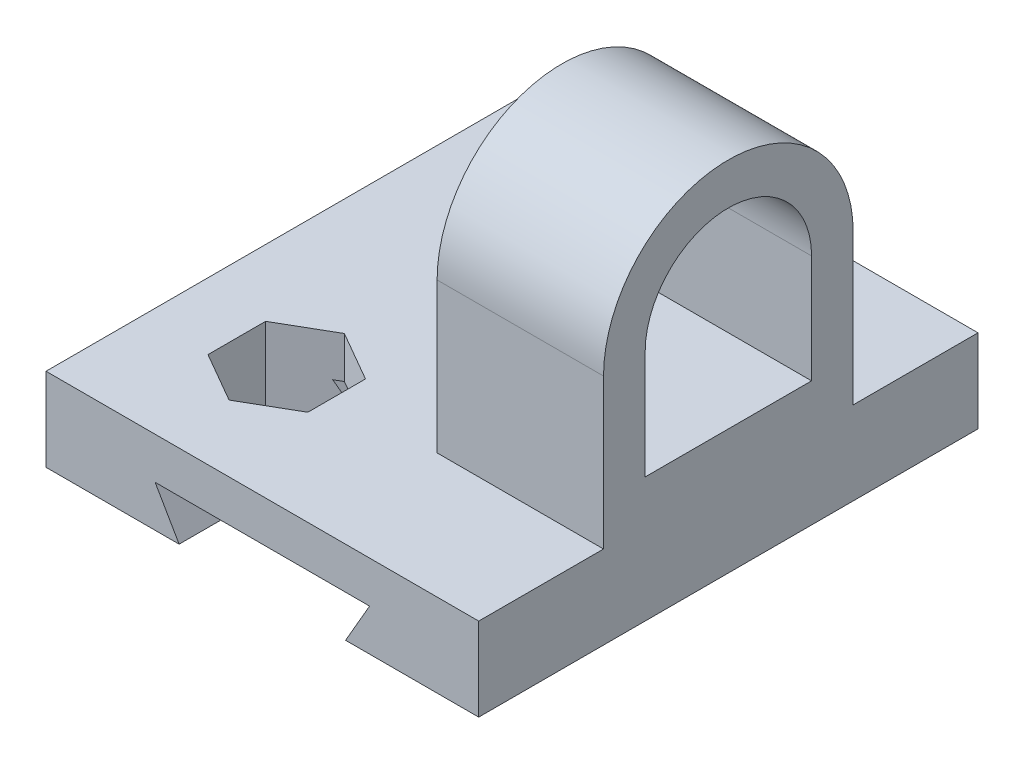
from build123d import *

# Parameters (mm, degrees)
EXTRUDE_2_DEPTH     = 30
EXTRUDE_START       = -20
EXTRUDE_1_DEPTH     = 20
CUT_EXTRUDE_1_REACH = 53.624


# Read off the part's stored shape, not the designer's step: 拉伸-薄壁1
with BuildPart() as part:
    # 草图1 → 凸台-拉伸2 (new, symmetric)
    with BuildSketch(Plane.XY):
        Polygon((-26, 5), (26, 5), (26, -5), (10, -5), (12.886751346, 0), (-12.886751346, 0), (-10, -5), (-26, -5), align=None)
    extrude(amount=EXTRUDE_2_DEPTH, both=True)

    # 拉伸-薄壁1 outline → 拉伸-薄壁1 (add)
    with BuildSketch(Plane(origin=(26, 0, 0), x_dir=(0, 0, -1), z_dir=(1, 0, 0)).offset(EXTRUDE_START)):
        with BuildLine():
            Line((15, 5), (15, 23))
            ThreePointArc((15, 23), (0, 38), (-15, 23))
            Line((-15, 23), (-15, 5))
            Line((-15, 5), (15, 5))
        make_face()
        with BuildLine():
            ThreePointArc((-10, 23), (0, 33), (10, 23))
            Line((10, 23), (10, 10))
            Line((10, 10), (-10, 10))
            Line((-10, 10), (-10, 23))
        make_face(mode=Mode.SUBTRACT)
    extrude(amount=EXTRUDE_1_DEPTH)

    # 草图6 → 切除-拉伸1 (cut, up to next)
    with BuildSketch(Plane(origin=(0, 5, 0), x_dir=(1, 0, 0), z_dir=(0, 1, 0)), mode=Mode.PRIVATE) as cut_extrude_1_sk1:
        Polygon((-6, -11.607695155), (-12, -8.143593539), (-18, -11.607695155), (-18, -18.535898385), (-12, -22), (-6, -18.535898385), align=None)
    cut_extrude_1_tool1 = extrude(cut_extrude_1_sk1.sketch, amount=-CUT_EXTRUDE_1_REACH, mode=Mode.PRIVATE) & part.part
    add(cut_extrude_1_tool1.solids().sort_by_distance((-12, 5, 15.071797))[0], mode=Mode.SUBTRACT)


solid = part.part
